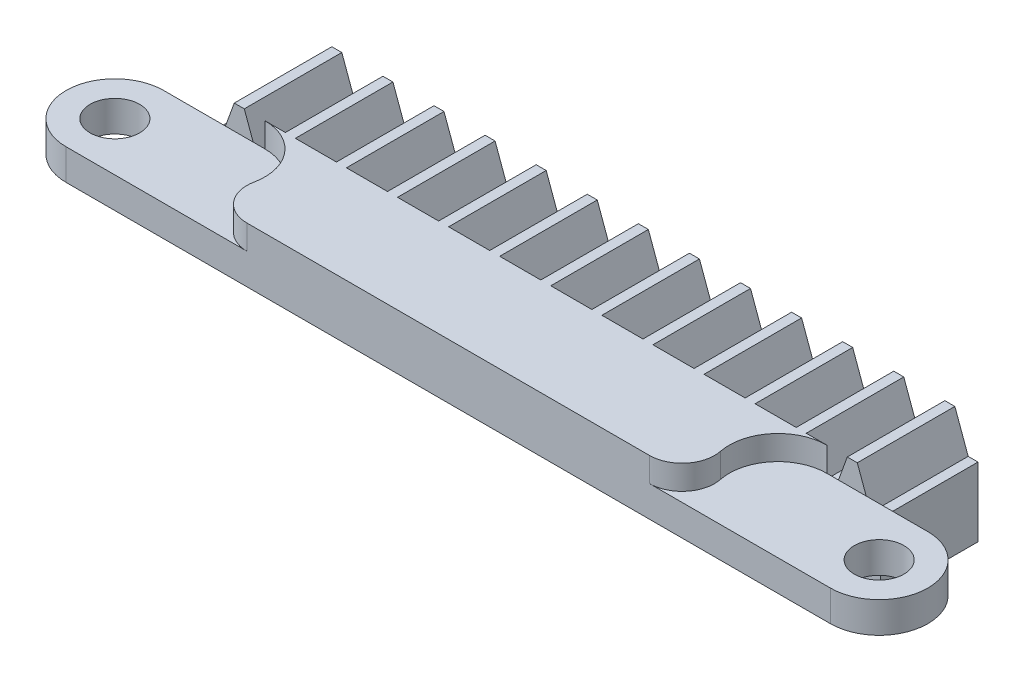
from build123d import *

# Parameters (mm, degrees)
BOSS_EXTRUDE1_DEPTH              = 6
SKETCH4_W                        = 33.355842528
SKETCH4_H                        = 6
BOSS_EXTRUDE3_DEPTH              = 3
BOSS_EXTRUDE4_DEPTH              = 33.355842528
SKETCH17_W                       = 28.5
SKETCH17_H                       = 1.9
BOSS_EXTRUDE11_DEPTH             = 6
SKETCH18_R                       = 1.525
BOSS_EXTRUDE12_DEPTH             = 1.9
SKETCH20_W                       = 34.55751915
SKETCH20_H                       = 1.75
BOSS_EXTRUDE13_DEPTH             = 6
SKETCH21_R                       = 3
CUT_EXTRUDE3_DEPTH               = 1.75
FILLET2_START                    = -9.24613882
FILLET2_DEPTH                    = 1.75
BOSS_EXTRUDE14_REACH             = 49.223
SKETCH22_W                       = 6
SKETCH22_H                       = 3
BOSS_EXTRUDE14_DIRECTION_2_REACH = 49.223
SPLIT1_START                     = -66.92498259
SPLIT1_DEPTH                     = 33.355842528
SPLIT1_START_2                   = -11.14613882
SPLIT1_2_DEPTH                   = 3.65
SPLIT1_3_OUTLINE_R               = 1.525
SPLIT1_3_DEPTH                   = 1.9
SPLIT1_START_3                   = 6.755649514
SPLIT1_4_DEPTH                   = 6
SKETCH26_W                       = 6
SKETCH26_H                       = 2.5
CUT_EXTRUDE4_DEPTH               = 51.815209001
SKETCH27_W                       = 6
SKETCH27_H                       = 0.25
CUT_EXTRUDE5_DEPTH               = 80.093428855


with BuildPart() as part:
    # Sketch1 → Boss-Extrude1 (new body)
    with BuildSketch(Plane(origin=(0, 0, 0.755649514), x_dir=(-1, 0, 0), z_dir=(0, 0, -1))):
        Polygon((31.089725273, -5.24613882), (30.270792245, -7.49613882), (29.667061326, -7.49613882), (29.667061326, -11.24613882), (70.667061326, -11.24613882), (70.827061326, -11.24613882), (70.827061326, -7.49613882), (70.667061326, -7.49613882), (70.222625956, -7.49613882), (69.403692929, -5.24613882), (68.788837073, -5.24613882), (67.969904045, -7.49613882), (67.081033306, -7.49613882), (66.262100279, -5.24613882), (65.647244423, -5.24613882), (64.828311395, -7.49613882), (63.939440656, -7.49613882), (63.120507629, -5.24613882), (62.505651773, -5.24613882), (61.686718745, -7.49613882), (60.797848006, -7.49613882), (59.978914979, -5.24613882), (59.364059123, -5.24613882), (58.545126095, -7.49613882), (57.656255356, -7.49613882), (56.837322329, -5.24613882), (56.222466473, -5.24613882), (55.403533445, -7.49613882), (54.514662706, -7.49613882), (53.695729679, -5.24613882), (53.080873823, -5.24613882), (52.261940795, -7.49613882), (51.373070056, -7.49613882), (50.554137029, -5.24613882), (49.939281173, -5.24613882), (49.120348145, -7.49613882), (48.231477406, -7.49613882), (47.412544379, -5.24613882), (46.797688523, -5.24613882), (45.978755495, -7.49613882), (45.089884756, -7.49613882), (44.270951729, -5.24613882), (43.656095873, -5.24613882), (42.837162845, -7.49613882), (41.948292106, -7.49613882), (41.129359079, -5.24613882), (40.514503223, -5.24613882), (39.695570195, -7.49613882), (38.806699456, -7.49613882), (37.987766429, -5.24613882), (37.372910573, -5.24613882), (36.553977545, -7.49613882), (35.665106806, -7.49613882), (34.846173779, -5.24613882), (34.231317923, -5.24613882), (33.412384895, -7.49613882), (32.523514156, -7.49613882), (31.704581129, -5.24613882), align=None)
    extrude(amount=-BOSS_EXTRUDE1_DEPTH)

    # Sketch4 → Boss-Extrude3 (add)
    with BuildSketch(Plane.XZ.offset(11.24613882)):
        with Locations((-50.247061326, 3.755649514)):
            Rectangle(SKETCH4_W, SKETCH4_H)
    extrude(amount=BOSS_EXTRUDE3_DEPTH)

    # Sketch5 → Boss-Extrude4 (add)
    with BuildSketch(Plane.ZY.offset(66.92498259)):
        Polygon((0.755649514, -11.24613882), (-1.244350486, -13.24613882), (-1.244350486, -14.24613882), (0.755649514, -14.24613882), align=None)
        Polygon((8.755649514, -13.24613882), (8.755649514, -14.24613882), (6.755649514, -14.24613882), (6.755649514, -11.24613882), align=None)
    extrude(amount=-BOSS_EXTRUDE4_DEPTH)

    # Sketch17 → Boss-Extrude11 (add)
    with BuildSketch(Plane.XY.offset(6.755649514)):
        with Locations((-50.247061326, -10.19613882)):
            Rectangle(SKETCH17_W, SKETCH17_H)
    extrude(amount=BOSS_EXTRUDE11_DEPTH)

    # Sketch18 → Boss-Extrude12 (add)
    with BuildSketch(Plane(origin=(0, -9.24613882, 0), x_dir=(1, 0, 0), z_dir=(0, 1, 0))):
        with BuildLine():
            Line((-73.747061326, -6.755649514), (-26.747061326, -6.755649514))
            ThreePointArc((-26.747061326, -6.755649514), (-23.747061326, -9.755649514), (-26.747061326, -12.755649514))
            Line((-26.747061326, -12.755649514), (-73.747061326, -12.755649514))
            ThreePointArc((-73.747061326, -12.755649514), (-76.747061326, -9.755649514), (-73.747061326, -6.755649514))
        make_face()
        with Locations(Location((-73.747061326, -9.755649514, 0), (0, 0, 270))):
            Circle(SKETCH18_R, mode=Mode.SUBTRACT)
        with Locations(Location((-26.747061326, -9.755649514, 0), (0, 0, 270))):
            Circle(SKETCH18_R, mode=Mode.SUBTRACT)
    extrude(amount=-BOSS_EXTRUDE12_DEPTH)

    # Sketch20 → Boss-Extrude13 (add)
    with BuildSketch(Plane.XY.offset(6.755649514)):
        with Locations((-50.246709101, -8.37113882)):
            Rectangle(SKETCH20_W, SKETCH20_H)
    extrude(amount=BOSS_EXTRUDE13_DEPTH)

    # Sketch21 → Cut-Extrude3 (cut)
    with BuildSketch(Plane(origin=(0, -7.49613882, 0), x_dir=(1, 0, 0), z_dir=(0, 1, 0))):
        with Locations((-67.525468676, -9.755649514)):
            Circle(SKETCH21_R)
        with Locations((-32.967949526, -9.755649514)):
            Circle(SKETCH21_R)
    extrude(amount=-CUT_EXTRUDE3_DEPTH, mode=Mode.SUBTRACT)

    # Fillet2: read off the stored shape, not the designer's step
    # Fillet2 outline → Fillet2 (cut)
    with BuildSketch(Plane(origin=(0, 0, 0), x_dir=(1, 0, 0), z_dir=(0, 1, 0)).offset(FILLET2_START)):
        with BuildLine():
            ThreePointArc((-35.907337217, -10.355649514), (-36.317735672, -12.020560578), (-37.866929011, -12.755649514))
            Line((-37.866929011, -12.755649514), (-32.967949526, -12.755649514))
            ThreePointArc((-32.967949526, -12.755649514), (-34.865316122, -12.079439522), (-35.907337217, -10.355649514))
        make_face()
        with BuildLine():
            ThreePointArc((-62.62648919, -12.755649514), (-64.175682529, -12.020560579), (-64.586080984, -10.355649514))
            ThreePointArc((-64.586080984, -10.355649514), (-65.62810208, -12.079439522), (-67.525468676, -12.755649514))
            Line((-67.525468676, -12.755649514), (-62.62648919, -12.755649514))
        make_face()
    extrude(amount=FILLET2_DEPTH, mode=Mode.SUBTRACT)

    # Boss-Extrude14: up to this face of the body (flat: up to its plane)
    boss_extrude14_end = Plane(part.part.faces().sort_by_distance((-70.827061326, -9.37113882, 3.755649514))[0])
    # Sketch22 → Boss-Extrude14 (add, up to the picked face)
    with BuildSketch(Plane.ZY.offset(66.92498259), mode=Mode.PRIVATE) as boss_extrude14_sk1:
        with Locations((3.755649514, -12.74613882)):
            Rectangle(SKETCH22_W, SKETCH22_H)
    boss_extrude14_tool1 = split(extrude(boss_extrude14_sk1.sketch, amount=BOSS_EXTRUDE14_REACH, mode=Mode.PRIVATE), bisect_by=boss_extrude14_end, keep=Keep.BOTH, mode=Mode.PRIVATE)
    add(boss_extrude14_tool1.solids().sort_by(Axis((-66.924983, -12.746139, 3.75565), (-1, 0, 0)))[0])

    # Boss-Extrude14 direction 2: up to this face of the body (flat: up to its plane)
    boss_extrude14_direction_2_end = Plane(part.part.faces().sort_by_distance((-29.667061326, -9.37113882, 3.755649514))[0])
    # Sketch22 → Boss-Extrude14 direction 2 (add, up to the picked face)
    with BuildSketch(Plane.ZY.offset(66.92498259), mode=Mode.PRIVATE) as boss_extrude14_direction_2_sk1:
        with Locations((3.755649514, -12.74613882)):
            Rectangle(SKETCH22_W, SKETCH22_H)
    boss_extrude14_direction_2_tool1 = split(extrude(boss_extrude14_direction_2_sk1.sketch, amount=-BOSS_EXTRUDE14_DIRECTION_2_REACH, mode=Mode.PRIVATE), bisect_by=boss_extrude14_direction_2_end, keep=Keep.BOTH, mode=Mode.PRIVATE)
    add(boss_extrude14_direction_2_tool1.solids().sort_by(Axis((-66.924983, -12.746139, 3.75565), (1, 0, 0)))[0])

    # Split1 4 outline → Split1 4 (cut)
    with BuildSketch(Plane.XY.offset(SPLIT1_START_3)):
        Polygon((-66.92498259, -14.24613882), (-33.569140062, -14.24613882), (-33.569140062, -11.14613882), (-22, -11.14613882), (-22, -7.49613882), (-78, -7.49613882), (-78, -11.14613882), (-66.92498259, -11.14613882), align=None)
    extrude(amount=SPLIT1_4_DEPTH, mode=Mode.SUBTRACT)

    # Sketch26 → Cut-Extrude4 (cut, through all)
    with BuildSketch(Plane(origin=(-29.667061326, 0, 0), x_dir=(0, 0, -1), z_dir=(1, 0, 0))):
        with Locations((-3.755649514, -9.24613882)):
            Rectangle(SKETCH26_W, SKETCH26_H)
    extrude(amount=-CUT_EXTRUDE4_DEPTH, mode=Mode.SUBTRACT)


with BuildPart() as body_2:
    # Split1: read off the stored shape, not the designer's step
    # Split1 outline → Split1 (new body)
    with BuildSketch(Plane.YZ.offset(SPLIT1_START)):
        Polygon((-14.24613882, 8.755649514), (-14.24613882, 6.755649514), (-11.24613882, 6.755649514), (-13.24613882, 8.755649514), align=None)
    extrude(amount=SPLIT1_DEPTH)


with BuildPart() as body_3:
    # Split1 2 outline → Split1 2 (new body)
    with BuildSketch(Plane(origin=(0, 0, 0), x_dir=(1, 0, 0), z_dir=(0, 1, 0)).offset(SPLIT1_START_2)):
        with BuildLine():
            Line((-32.967949526, -6.755649514), (-67.525468676, -6.755649514))
            ThreePointArc((-67.525468676, -6.755649514), (-65.201678668, -7.858282918), (-64.586080984, -10.355649514))
            ThreePointArc((-64.586080984, -10.355649514), (-64.175682529, -12.020560579), (-62.62648919, -12.755649514))
            Line((-62.62648919, -12.755649514), (-37.866929011, -12.755649514))
            ThreePointArc((-37.866929011, -12.755649514), (-36.317735672, -12.020560578), (-35.907337217, -10.355649514))
            ThreePointArc((-35.907337217, -10.355649514), (-35.291739533, -7.858282918), (-32.967949526, -6.755649514))
        make_face()
    extrude(amount=SPLIT1_2_DEPTH)

    # Split1 3 outline → Split1 3 (add)
    # profile 1 of 2: a face of its own
    with BuildSketch(Plane(origin=(0, 0, 0), x_dir=(1, 0, 0), z_dir=(0, 1, 0)).offset(SPLIT1_START_2)):
        with BuildLine():
            Line((-67.525468676, -6.755649514), (-73.747061326, -6.755649514))
            ThreePointArc((-73.747061326, -6.755649514), (-76.747061326, -9.755649514), (-73.747061326, -12.755649514))
            Line((-73.747061326, -12.755649514), (-62.62648919, -12.755649514))
            ThreePointArc((-62.62648919, -12.755649514), (-64.175682529, -12.020560579), (-64.586080984, -10.355649514))
            ThreePointArc((-64.586080984, -10.355649514), (-65.201678668, -7.858282918), (-67.525468676, -6.755649514))
        make_face()
        with Locations((-73.747061326, -9.755649514)):
            Circle(SPLIT1_3_OUTLINE_R, mode=Mode.SUBTRACT)
    # profile 2 of 2: a face of its own
    with BuildSketch(Plane(origin=(0, 0, 0), x_dir=(1, 0, 0), z_dir=(0, 1, 0)).offset(SPLIT1_START_2)):
        with BuildLine():
            Line((-26.747061326, -6.755649514), (-32.967949526, -6.755649514))
            ThreePointArc((-32.967949526, -6.755649514), (-35.291739533, -7.858282918), (-35.907337217, -10.355649514))
            ThreePointArc((-35.907337217, -10.355649514), (-36.317735672, -12.020560578), (-37.866929011, -12.755649514))
            Line((-37.866929011, -12.755649514), (-26.747061326, -12.755649514))
            ThreePointArc((-26.747061326, -12.755649514), (-23.747061326, -9.755649514), (-26.747061326, -6.755649514))
        make_face()
        with Locations((-26.747061326, -9.755649514)):
            Circle(SPLIT1_3_OUTLINE_R, mode=Mode.SUBTRACT)
    extrude(amount=SPLIT1_3_DEPTH)


with BuildPart() as cut_extrude4_piece_1:
    # of the separate pieces the step leaves, piece 1, a body of its own (cut_extrude4_pieces)
    add(part.part.solids().sort_by_distance((-29.667061326, -10.49613882, 0.755649514))[0])


with BuildPart() as cut_extrude4_piece_2:
    # of the separate pieces the step leaves, piece 2, a body of its own (cut_extrude4_pieces)
    add(part.part.solids().sort_by_distance((-31.089725273, -5.24613882, 0.755649514))[0])


with BuildPart() as cut_extrude4_piece_2_1:
    # Body-Move/Copy1: read off the stored shape, not the designer's step
    # Body-Move/Copy1: moved
    add(cut_extrude4_piece_2.part.moved(Location((0, -2.5, 0))))


with BuildPart() as cut_extrude4_piece_1_1:
    add(cut_extrude4_piece_1.part)

    # Combine1: union Cut-Extrude4 piece 2, body 3, body 2
    add(cut_extrude4_piece_2_1.part)
    add(body_3.part)
    add(body_2.part)

    # Sketch27 → Cut-Extrude5 (cut, through all)
    with BuildSketch(Plane(origin=(0, 0, 0), x_dir=(0, 0, -1), z_dir=(1, 0, 0))):
        with Locations((-9.755649514, -7.62113882)):
            Rectangle(SKETCH27_W, SKETCH27_H)
    extrude(amount=-CUT_EXTRUDE5_DEPTH, mode=Mode.SUBTRACT)


solid = cut_extrude4_piece_1_1.part
